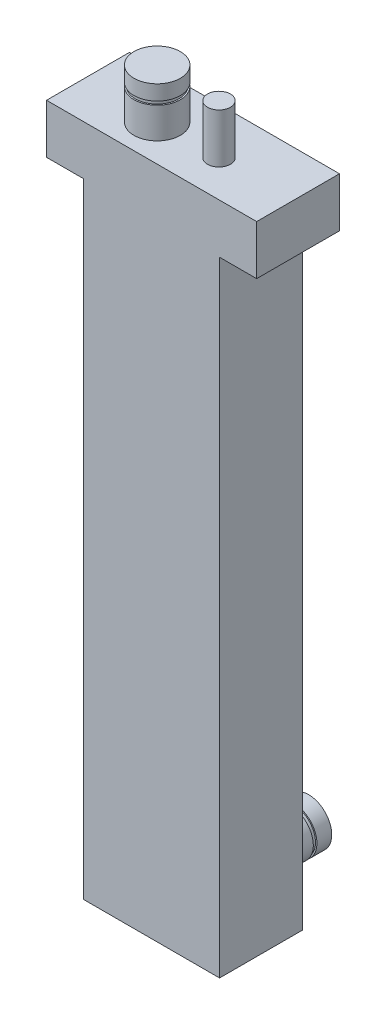
from build123d import *

# Parameters (mm, degrees)
SKETCH1_W              = 33.02
SKETCH1_H              = 19.05
BOSS_EXTRUDE1_DEPTH    = 10.16
SKETCH2_R              = 4.7625
SKETCH2_R_2            = 2.357295936
BOSS_EXTRUDE2_DEPTH    = 10.16
SKETCH5_W              = 19.05
SKETCH5_H              = 10.16
BOSS_EXTRUDE3_DEPTH    = 5.08
SKETCH6_W              = 19.05
SKETCH6_H              = 10.16
BOSS_EXTRUDE4_DEPTH    = 5.08
SKETCH7_W              = 27.94
SKETCH7_H              = 19.05
BOSS_EXTRUDE5_DEPTH    = 128.27
SKETCH9_R              = 4.7625
BOSS_EXTRUDE6_DEPTH    = 15.24
CUT_EXTRUDE3_START     = -21.717
CUT_EXTRUDE3_OUTLINE_R = 4.7625
CUT_EXTRUDE3_DEPTH     = 0.7366
SKETCH13_R             = 4.4704
BOSS_EXTRUDE8_DEPTH    = 0.7366
SKETCH14_W             = 27.94
SKETCH14_H             = 10.16
CUT_EXTRUDE4_DEPTH     = 15.24
SKETCH15_W             = 43.18
SKETCH15_H             = 138.43
CUT_EXTRUDE5_DEPTH     = 2.032
CUT_EXTRUDE6_START     = 16.51
CUT_EXTRUDE6_OUTLINE_R = 4.7625
CUT_EXTRUDE6_DEPTH     = 0.7366
SKETCH16_R             = 4.4704
BOSS_EXTRUDE9_DEPTH    = 0.7366


# Read off the part's stored shape, not the designer's step: Cut-Extrude3, Cut-Extrude6
with BuildPart() as part:
    # Sketch1 → Boss-Extrude1 (new body)
    with BuildSketch(Plane(origin=(0, 0, 0), x_dir=(1, 0, 0), z_dir=(0, 1, 0))):
        with Locations((-5.08, 0)):
            Rectangle(SKETCH1_W, SKETCH1_H)
    extrude(amount=BOSS_EXTRUDE1_DEPTH)

    # Sketch2 → Boss-Extrude2 (add)
    with BuildSketch(Plane(origin=(0, 10.16, 0), x_dir=(1, 0, 0), z_dir=(0, 1, 0))):
        with Locations(Location((-11.43, 0, 0), (0, 0, 270))):
            Circle(SKETCH2_R)
        with Locations(Location((1.27, 0, 0), (0, 0, 270))):
            Circle(SKETCH2_R_2)
    extrude(amount=BOSS_EXTRUDE2_DEPTH)

    # Sketch5 → Boss-Extrude3 (add)
    with BuildSketch(Plane.ZY.offset(21.59)):
        with Locations((0, 5.08)):
            Rectangle(SKETCH5_W, SKETCH5_H)
    extrude(amount=BOSS_EXTRUDE3_DEPTH)

    # Sketch6 → Boss-Extrude4 (add)
    with BuildSketch(Plane(origin=(11.43, 0, 0), x_dir=(0, 0, -1), z_dir=(1, 0, 0))):
        with Locations((0, 5.08)):
            Rectangle(SKETCH6_W, SKETCH6_H)
    extrude(amount=BOSS_EXTRUDE4_DEPTH)

    # Sketch7 → Boss-Extrude5 (add)
    with BuildSketch(Plane(origin=(0, 0, 0), x_dir=(-1, 0, 0), z_dir=(0, -1, 0))):
        with Locations((5.08, 0)):
            Rectangle(SKETCH7_W, SKETCH7_H)
    extrude(amount=BOSS_EXTRUDE5_DEPTH)

    # Sketch9 → Boss-Extrude6 (add)
    with BuildSketch(Plane.XY.offset(9.525)):
        with Locations(Location((-5.08, -123.5075, 0), (0, 0, 270))):
            Circle(SKETCH9_R)
    boss_extrude6 = extrude(amount=BOSS_EXTRUDE6_DEPTH)

    # Mirror5: Boss-Extrude6 across plane
    add(boss_extrude6.mirror(Plane.XY))

    # Cut-Extrude3 outline → Cut-Extrude3 (cut)
    with BuildSketch(Plane.XY.offset(CUT_EXTRUDE3_START)):
        with Locations((-5.08, -123.5075)):
            Circle(CUT_EXTRUDE3_OUTLINE_R)
    extrude(amount=CUT_EXTRUDE3_DEPTH, mode=Mode.SUBTRACT)

    # Sketch13 → Boss-Extrude8 (add)
    with BuildSketch(Plane(origin=(0, 0, -20.9804), x_dir=(-1, 0, 0), z_dir=(0, 0, -1))):
        with Locations(Location((5.08, -123.5075, 0), (0, 0, 180))):
            Circle(SKETCH13_R)
    extrude(amount=BOSS_EXTRUDE8_DEPTH)

    # Sketch14 → Cut-Extrude4 (cut)
    with BuildSketch(Plane.XY.offset(9.525)):
        with Locations((-5.08, -123.19)):
            Rectangle(SKETCH14_W, SKETCH14_H)
    extrude(amount=CUT_EXTRUDE4_DEPTH, mode=Mode.SUBTRACT)

    # Sketch15 → Cut-Extrude5 (cut)
    with BuildSketch(Plane.XY.offset(9.525)):
        with Locations((-5.08, -59.055)):
            Rectangle(SKETCH15_W, SKETCH15_H)
    extrude(amount=-CUT_EXTRUDE5_DEPTH, mode=Mode.SUBTRACT)

    # Cut-Extrude6 outline → Cut-Extrude6 (cut)
    with BuildSketch(Plane(origin=(0, 0, 0), x_dir=(1, 0, 0), z_dir=(0, 1, 0)).offset(CUT_EXTRUDE6_START)):
        with Locations((-11.43, 0)):
            Circle(CUT_EXTRUDE6_OUTLINE_R)
    extrude(amount=CUT_EXTRUDE6_DEPTH, mode=Mode.SUBTRACT)

    # Sketch16 → Boss-Extrude9 (add)
    with BuildSketch(Plane(origin=(0, 16.51, 0), x_dir=(1, 0, 0), z_dir=(0, 1, 0))):
        with Locations(Location((-11.43, 0, 0), (0, 0, 270))):
            Circle(SKETCH16_R)
    extrude(amount=BOSS_EXTRUDE9_DEPTH)


solid = part.part
